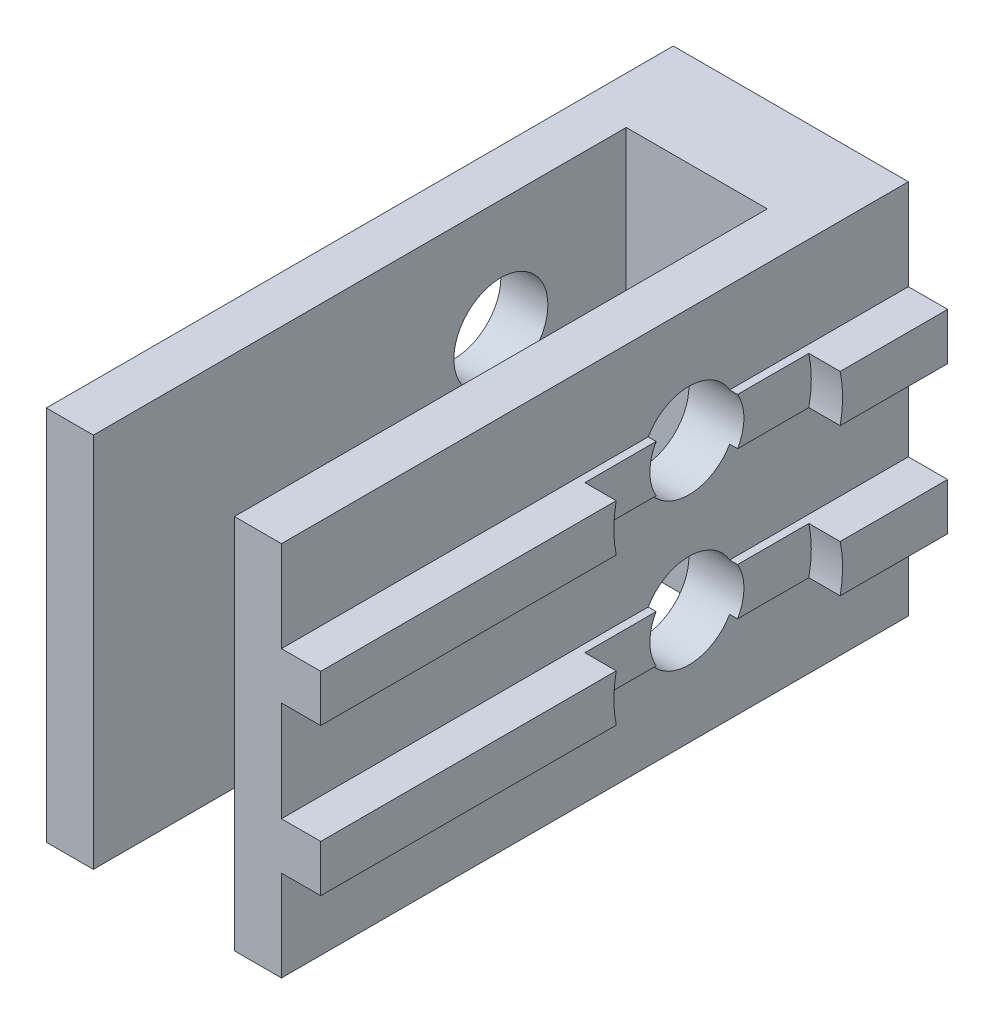
from build123d import *

# Parameters (mm, degrees)
BOSS_EXTRUDE1_DEPTH = 20
SKETCH2_W           = 4.5
SKETCH2_H           = 12
CUT_EXTRUDE1_DEPTH  = 17
SKETCH3_R           = 1.5
CUT_EXTRUDE2_DEPTH  = 1
SKETCH3_3_R         = 1.5
CUT_EXTRUDE3_DEPTH  = 25.912212356


with BuildPart() as part:
    # Sketch1 → Boss-Extrude1 (new body)
    with BuildSketch(Plane.XY):
        Polygon((7.5, 9.1), (8.753189388, 9.1), (8.753189388, 7.6), (7.5, 7.6), (7.5, 4.4), (8.753189388, 4.4), (8.753189388, 2.9), (7.5, 2.9), (7.5, 0), (0, 0), (0, 12), (7.5, 12), align=None)
    extrude(amount=BOSS_EXTRUDE1_DEPTH)

    # Sketch2 → Cut-Extrude1 (cut)
    with BuildSketch(Plane.XY.offset(20)):
        with Locations((3.75, 6)):
            Rectangle(SKETCH2_W, SKETCH2_H)
    extrude(amount=-CUT_EXTRUDE1_DEPTH, mode=Mode.SUBTRACT)

    # Sketch3 → Cut-Extrude2 (cut)
    with BuildSketch(Plane(origin=(8.753189388, 0, 0), x_dir=(0, 0, -1), z_dir=(1, 0, 0))):
        with BuildLine():
            ThreePointArc((-9.792848009, 6), (-7, 0), (-4.207151991, 6))
            ThreePointArc((-4.207151991, 6), (-7, 12), (-9.792848009, 6))
        make_face()
        with Locations((-7, 8.35)):
            Circle(SKETCH3_R, mode=Mode.SUBTRACT)
        with Locations((-7, 3.65)):
            Circle(SKETCH3_R, mode=Mode.SUBTRACT)
    extrude(amount=-CUT_EXTRUDE2_DEPTH, mode=Mode.SUBTRACT)

    # Sketch3<3> → Cut-Extrude3 (cut, through all)
    with BuildSketch(Plane(origin=(8.753189388, 0, 0), x_dir=(0, 0, -1), z_dir=(1, 0, 0))):
        with Locations((-7, 8.35)):
            Circle(SKETCH3_3_R)
        with Locations((-7, 3.65)):
            Circle(SKETCH3_3_R)
    extrude(amount=-CUT_EXTRUDE3_DEPTH, mode=Mode.SUBTRACT)


solid = part.part
